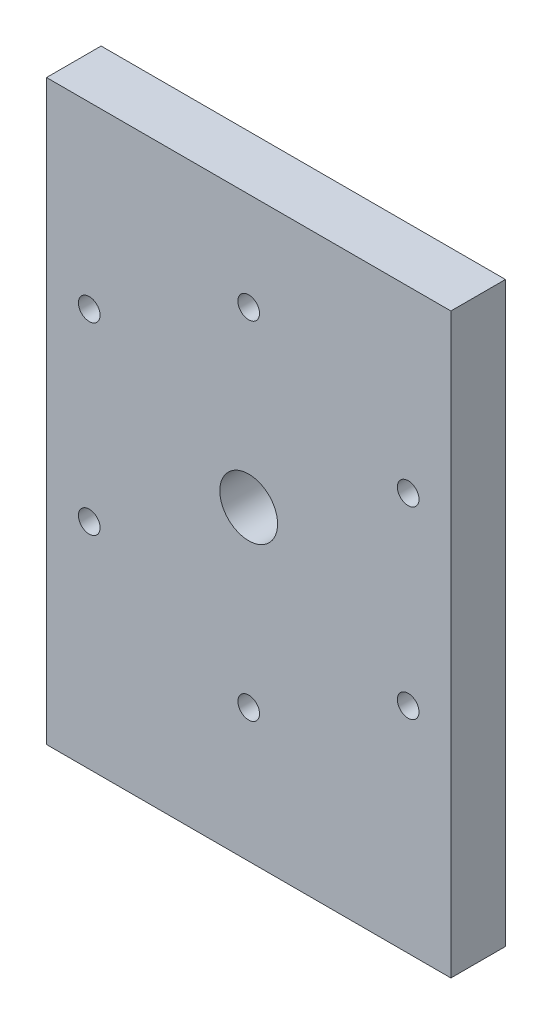
from build123d import *

# Parameters (mm, degrees)
SKETCH1_W                  = 88.9
SKETCH1_H                  = 127
SKETCH1_R                  = 6.35
BOSS_EXTRUDE1_DEPTH        = 12.0000014
SKETCH2_R                  = 2.38125
CUT_EXTRUDE1_DEPTH         = 136.088128766
SKETCH3_R                  = 1.27
CUT_EXTRUDE2_DEPTH         = 12.7
F_10_32_TAPPED_HOLE3_D     = 4.0386
F_10_32_TAPPED_HOLE3_DEPTH = 12.7
F_10_32_TAPPED_HOLE3_TIP   = 1.213317848


with BuildPart() as part:
    # Sketch1 → Boss-Extrude1 (new body)
    with BuildSketch(Plane.XY):
        with Locations((0, 63.5)):
            Rectangle(SKETCH1_W, SKETCH1_H)
        with Locations((0, 67.3749986)):
            Circle(SKETCH1_R, mode=Mode.SUBTRACT)
    extrude(amount=BOSS_EXTRUDE1_DEPTH)

    # Sketch2 → Cut-Extrude1 (cut, through all)
    with BuildSketch(Plane(origin=(0, 0, 0), x_dir=(-1, 0, 0), z_dir=(0, 0, -1))):
        with Locations((0, 105.4749986)):
            Circle(SKETCH2_R)
        with Locations((0, 29.2749986)):
            Circle(SKETCH2_R)
        with Locations((-35.057790877, 87.6156236)):
            Circle(SKETCH2_R)
        with Locations((-35.057790877, 47.1343736)):
            Circle(SKETCH2_R)
        with Locations((35.057790877, 47.1343736)):
            Circle(SKETCH2_R)
        with Locations((35.057790877, 87.6156236)):
            Circle(SKETCH2_R)
    extrude(amount=-CUT_EXTRUDE1_DEPTH, mode=Mode.SUBTRACT)

    # Sketch3 → Cut-Extrude2 (cut)
    with BuildSketch(Plane.XZ):
        with Locations((31.75, 6.0000007)):
            Circle(SKETCH3_R)
        with Locations((0, 6.0000007)):
            Circle(SKETCH3_R)
        with Locations((-31.75, 6.0000007)):
            Circle(SKETCH3_R)
    extrude(amount=-CUT_EXTRUDE2_DEPTH, mode=Mode.SUBTRACT)

    # #10-32 Tapped Hole3
    with Locations(Plane(origin=(0, 0, 0), x_dir=(-1, 0, 0), z_dir=(0, -1, 0))):
        with Locations((-31.75, -6.0000007), (0, -6.0000007), (31.75, -6.0000007)):
            Hole(F_10_32_TAPPED_HOLE3_D / 2, depth=F_10_32_TAPPED_HOLE3_DEPTH)
            with Locations((0, 0, -(F_10_32_TAPPED_HOLE3_DEPTH + F_10_32_TAPPED_HOLE3_TIP / 2))):  # 118° drill point
                Cone(0, F_10_32_TAPPED_HOLE3_D / 2, F_10_32_TAPPED_HOLE3_TIP, mode=Mode.SUBTRACT)


solid = part.part
